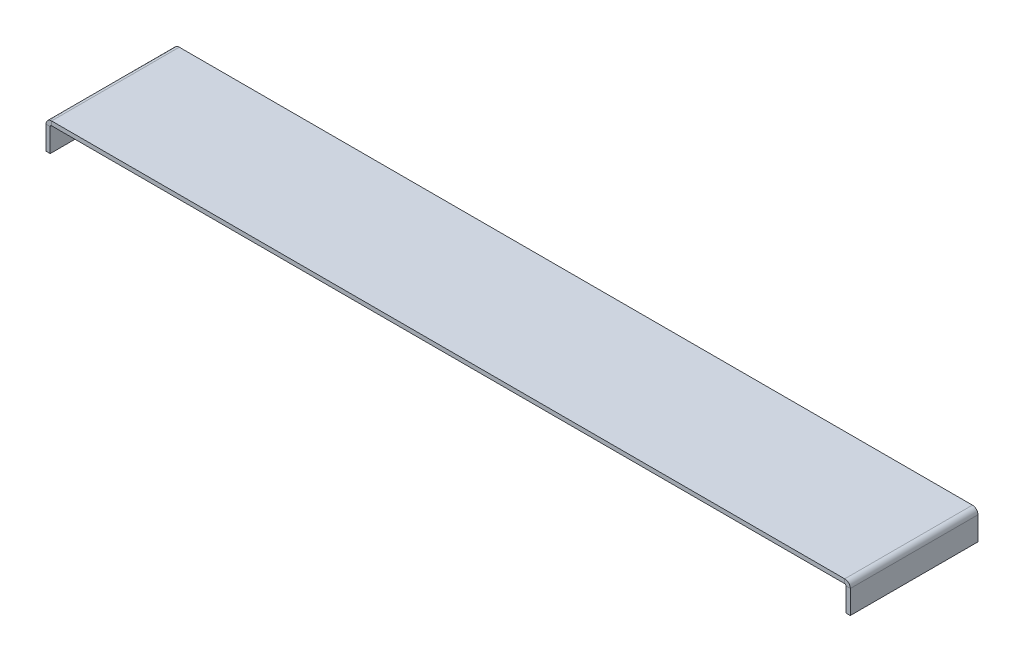
from build123d import *

# Parameters (mm, degrees)
BASE_FLANGE1_DEPTH = 34.925


# Sheet-metal steps are written as plain solids
with BuildPart() as part:
    # Sketch2 → Base-Flange1 (new, symmetric)
    with BuildSketch(Plane.XY):
        with BuildLine():
            Line((-219.964, -15.875), (-219.964, -3.048))
            ThreePointArc((-219.964, -3.048), (-219.071261469, -0.892738531), (-216.916, 0))
            Line((-216.916, 0), (216.916, 0))
            ThreePointArc((216.916, 0), (219.071261469, -0.892738531), (219.964, -3.048))
            Line((219.964, -3.048), (219.964, -15.875))
            Line((219.964, -15.875), (217.678, -15.875))
            Line((217.678, -15.875), (217.678, -3.048))
            ThreePointArc((217.678, -3.048), (217.454815367, -2.509184633), (216.916, -2.286))
            Line((216.916, -2.286), (-216.916, -2.286))
            ThreePointArc((-216.916, -2.286), (-217.454815367, -2.509184633), (-217.678, -3.048))
            Line((-217.678, -3.048), (-217.678, -15.875))
            Line((-217.678, -15.875), (-219.964, -15.875))
        make_face()
    extrude(amount=BASE_FLANGE1_DEPTH, both=True)


solid = part.part
